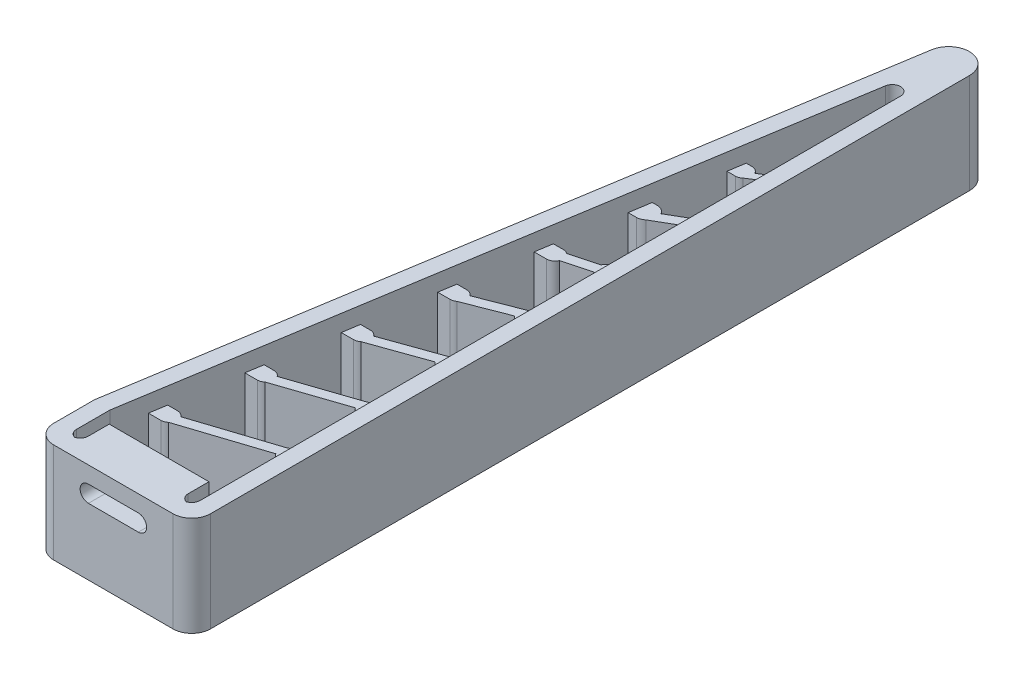
from build123d import *

# Parameters (mm, degrees)
BOSS_EXTRUDE1_DEPTH     = 6
BOSS_EXTRUDE2_DEPTH     = 4
SKETCH6_R               = 0.5
CUT_EXTRUDE1_DEPTH      = 1
FILL_START              = -19.748812638
FILL_PATTERN1_OUTLINE_R = 0.5
FILL_PATTERN1_DEPTH     = 1
FILLET1_R               = 2.25
FILLET2_R               = 1
CUT_EXTRUDE2_DEPTH      = 10


# Read off the part's stored shape, not the designer's step: Fill Pattern1
with BuildPart() as part:
    # Sketch1 → Boss-Extrude1 (new, symmetric)
    with BuildSketch(Plane(origin=(0, 0, 0), x_dir=(1, 0, 0), z_dir=(0, 1, 0))):
        with BuildLine():
            Line((0, 93.551263874), (0, 0))
            Line((0, 0), (-18.854561776, 0))
            Line((-18.854561776, 0), (-18.854561776, 7.158988901))
            Line((-18.854561776, 7.158988901), (-4.96860158, 93.946240126))
            ThreePointArc((-4.96860158, 93.946240126), (-2.301888856, 96.043401906), (0, 93.551263874))
        make_face()
        with BuildLine():
            Line((-16.854561776, 7), (-3.987440632, 87.419507149))
            ThreePointArc((-3.987440632, 87.419507149), (-2.920755543, 88.258371861), (-2, 87.261516648))
            Line((-2, 87.261516648), (-2, 2))
            Line((-2, 2), (-3.427280888, 2))
            Line((-3.427280888, 2), (-3.427280888, 5.5))
            Line((-3.427280888, 5.5), (-15.427280888, 5.5))
            Line((-15.427280888, 5.5), (-15.427280888, 2))
            Line((-15.427280888, 2), (-16.854561776, 2))
            Line((-16.854561776, 2), (-16.854561776, 7))
        make_face(mode=Mode.SUBTRACT)
    extrude(amount=BOSS_EXTRUDE1_DEPTH, both=True)

    # Sketch3 → Boss-Extrude2 (add, symmetric)
    with BuildSketch(Plane(origin=(0, 0, 0), x_dir=(1, 0, 0), z_dir=(0, 1, 0))):
        with BuildLine():
            ThreePointArc((-13.894581708, 12.572392076), (-14.252172371, 12.886676964), (-14.714561776, 13))
            Line((-14.714561776, 13), (-15.894561776, 13))
            Line((-15.894561776, 13), (-16.214561776, 11))
            Line((-16.214561776, 11), (-14.714561776, 11))
            ThreePointArc((-14.714561776, 11), (-14.351709518, 11.068153318), (-14.03831643, 11.263323523))
            Line((-14.03831643, 11.263323523), (-4.319980068, 14.432540695))
            ThreePointArc((-4.319980068, 14.432540695), (-3.962389405, 14.118255808), (-3.5, 14.004932771))
            Line((-3.5, 14.004932771), (-2, 14.004932771))
            Line((-2, 14.004932771), (-2, 16.004932771))
            Line((-2, 16.004932771), (-3.5, 16.004932771))
            ThreePointArc((-3.5, 16.004932771), (-3.862852258, 15.936779453), (-4.176245346, 15.741609249))
            Line((-4.176245346, 15.741609249), (-13.894581708, 12.572392076))
        make_face()
        with BuildLine():
            ThreePointArc((-3.5, 25.576214063), (-3.855885274, 25.510743716), (-4.165170683, 25.322905407))
            Line((-4.165170683, 25.322905407), (-12.294644799, 22.572482446))
            ThreePointArc((-12.294644799, 22.572482446), (-12.652221234, 22.886702443), (-13.114561776, 23))
            Line((-13.114561776, 23), (-14.294561776, 23))
            Line((-14.294561776, 23), (-14.614561776, 21))
            Line((-14.614561776, 21), (-13.114561776, 21))
            ThreePointArc((-13.114561776, 21), (-12.758676502, 21.065470347), (-12.449391093, 21.253308656))
            Line((-12.449391093, 21.253308656), (-4.319916977, 24.003731617))
            ThreePointArc((-4.319916977, 24.003731617), (-3.962340542, 23.68951162), (-3.5, 23.576214063))
            Line((-3.5, 23.576214063), (-2, 23.576214063))
            Line((-2, 23.576214063), (-2, 25.576214063))
            Line((-2, 25.576214063), (-3.5, 25.576214063))
        make_face()
        with BuildLine():
            Line((-3.5, 33.147495356), (-2, 33.147495356))
            Line((-2, 33.147495356), (-2, 35.147495356))
            Line((-2, 35.147495356), (-3.5, 35.147495356))
            ThreePointArc((-3.5, 35.147495356), (-3.839457159, 35.088116872), (-4.138601415, 34.91703303))
            Line((-4.138601415, 34.91703303), (-10.696730072, 32.575457474))
            ThreePointArc((-10.696730072, 32.575457474), (-11.05383272, 32.887540837), (-11.514561776, 33))
            Line((-11.514561776, 33), (-12.694561776, 33))
            Line((-12.694561776, 33), (-13.014561776, 31))
            Line((-13.014561776, 31), (-11.514561776, 31))
            ThreePointArc((-11.514561776, 31), (-11.17076538, 31.060955785), (-10.868881742, 31.236391923))
            Line((-10.868881742, 31.236391923), (-4.319739543, 33.57475887))
            ThreePointArc((-4.319739543, 33.57475887), (-3.962203156, 33.26072129), (-3.5, 33.147495356))
        make_face()
        with BuildLine():
            Line((-3.5, 42.718776648), (-2, 42.718776648))
            Line((-2, 42.718776648), (-2, 44.718776648))
            Line((-2, 44.718776648), (-3.5, 44.718776648))
            ThreePointArc((-3.5, 44.718776648), (-3.816868443, 44.667246146), (-4.101080107, 44.517965427))
            Line((-4.101080107, 44.517965427), (-9.095345948, 42.573485333))
            ThreePointArc((-9.095345948, 42.573485333), (-9.45276384, 42.886985156), (-9.914561776, 43))
            Line((-9.914561776, 43), (-11.094561776, 43))
            Line((-11.094561776, 43), (-11.414561776, 41))
            Line((-11.414561776, 41), (-9.914561776, 41))
            ThreePointArc((-9.914561776, 41), (-9.597693333, 41.051530501), (-9.313481669, 41.20081122))
            Line((-9.313481669, 41.20081122), (-4.319215828, 43.145291315))
            ThreePointArc((-4.319215828, 43.145291315), (-3.961797936, 42.831791492), (-3.5, 42.718776648))
        make_face()
        with BuildLine():
            ThreePointArc((-3.5, 54.29005794), (-4.060133797, 54.118460094), (-4.428032088, 53.662558199))
            Line((-4.428032088, 53.662558199), (-7.697112542, 52.786610732))
            ThreePointArc((-7.697112542, 52.786610732), (-7.98792033, 52.94514833), (-8.314561776, 53))
            Line((-8.314561776, 53), (-9.494561776, 53))
            Line((-9.494561776, 53), (-9.814561776, 51))
            Line((-9.814561776, 51), (-8.314561776, 51))
            ThreePointArc((-8.314561776, 51), (-7.754427979, 51.171597845), (-7.386529688, 51.62749974))
            Line((-7.386529688, 51.62749974), (-4.117449234, 52.503447208))
            ThreePointArc((-4.117449234, 52.503447208), (-3.826641446, 52.34490961), (-3.5, 52.29005794))
            Line((-3.5, 52.29005794), (-2, 52.29005794))
            Line((-2, 52.29005794), (-2, 54.29005794))
            Line((-2, 54.29005794), (-3.5, 54.29005794))
        make_face()
        with BuildLine():
            Line((-2, 71.640764886), (-2, 73.640764886))
            Line((-2, 73.640764886), (-2.6, 73.640764886))
            ThreePointArc((-2.6, 73.640764886), (-2.962784917, 73.572637787), (-3.276138866, 73.377539094))
            Line((-3.276138866, 73.377539094), (-4.72720833, 72.461089863))
            ThreePointArc((-4.72720833, 72.461089863), (-5.095471159, 72.854719212), (-5.614561776, 73))
            Line((-5.614561776, 73), (-6.294561776, 73))
            Line((-6.294561776, 73), (-6.614561776, 71))
            Line((-6.614561776, 71), (-5.614561776, 71))
            ThreePointArc((-5.614561776, 71), (-5.251776859, 71.068127099), (-4.93842291, 71.263225792))
            Line((-4.93842291, 71.263225792), (-3.487353446, 72.179675023))
            ThreePointArc((-3.487353446, 72.179675023), (-3.119090617, 71.786045674), (-2.6, 71.640764886))
            Line((-2.6, 71.640764886), (-2, 71.640764886))
        make_face()
        with BuildLine():
            Line((-2, 61.997186069), (-2, 64.497186069))
            Line((-2, 64.497186069), (-2.6, 64.497186069))
            ThreePointArc((-2.6, 64.497186069), (-3.040392748, 64.417038294), (-3.424311098, 64.186872833))
            Line((-3.424311098, 64.186872833), (-6.159837979, 62.603390263))
            ThreePointArc((-6.159837979, 62.603390263), (-6.618848723, 63.076275483), (-7.254561776, 63.25))
            Line((-7.254561776, 63.25), (-7.854561776, 63.25))
            Line((-7.854561776, 63.25), (-8.254561776, 60.75))
            Line((-8.254561776, 60.75), (-7.254561776, 60.75))
            ThreePointArc((-7.254561776, 60.75), (-6.814169028, 60.830147775), (-6.430250678, 61.060313236))
            Line((-6.430250678, 61.060313236), (-3.694723797, 62.643795806))
            ThreePointArc((-3.694723797, 62.643795806), (-3.235713053, 62.170910586), (-2.6, 61.997186069))
            Line((-2.6, 61.997186069), (-2, 61.997186069))
        make_face()
    extrude(amount=BOSS_EXTRUDE2_DEPTH, both=True)

    # Sketch6 → Cut-Extrude1 (cut)
    with BuildSketch(Plane(origin=(-19.500780031, 0, -3.120124805), x_dir=(-0.15799050110667284, 0, 0.9874406319167055), z_dir=(-0.9874406319167055, 0, -0.15799050110667284))):
        with Locations((-47.590234861, 0)):
            Circle(SKETCH6_R)
    extrude(amount=-CUT_EXTRUDE1_DEPTH, mode=Mode.SUBTRACT)

    # Fill Pattern1 outline → Fill Pattern1 (cut)
    with BuildSketch(Plane(origin=(0, 0, 0), x_dir=(0, 1, 0), z_dir=(0.9874406319167054, 0, 0.1579905011066731)).offset(FILL_START)):
        with Locations((3, -44.590234861)):
            Circle(FILL_PATTERN1_OUTLINE_R)
        with Locations((3, -83.590234861)):
            Circle(FILL_PATTERN1_OUTLINE_R)
        with Locations((3, -8.590234861)):
            Circle(FILL_PATTERN1_OUTLINE_R)
        with Locations((0, -8.590234861)):
            Circle(FILL_PATTERN1_OUTLINE_R)
        with Locations((-3, -8.590234861)):
            Circle(FILL_PATTERN1_OUTLINE_R)
        with Locations((-3, -86.590234861)):
            Circle(FILL_PATTERN1_OUTLINE_R)
        with Locations((0, -86.590234861)):
            Circle(FILL_PATTERN1_OUTLINE_R)
        with Locations((3, -86.590234861)):
            Circle(FILL_PATTERN1_OUTLINE_R)
        with Locations((3, -5.590234861)):
            Circle(FILL_PATTERN1_OUTLINE_R)
        with Locations((-3, -80.590234861)):
            Circle(FILL_PATTERN1_OUTLINE_R)
        with Locations((0, -80.590234861)):
            Circle(FILL_PATTERN1_OUTLINE_R)
        with Locations((3, -80.590234861)):
            Circle(FILL_PATTERN1_OUTLINE_R)
        with Locations((3, -11.590234861)):
            Circle(FILL_PATTERN1_OUTLINE_R)
        with Locations((0, -11.590234861)):
            Circle(FILL_PATTERN1_OUTLINE_R)
        with Locations((-3, -11.590234861)):
            Circle(FILL_PATTERN1_OUTLINE_R)
        with Locations((-3, -83.590234861)):
            Circle(FILL_PATTERN1_OUTLINE_R)
        with Locations((0, -83.590234861)):
            Circle(FILL_PATTERN1_OUTLINE_R)
        with Locations((0, -5.590234861)):
            Circle(FILL_PATTERN1_OUTLINE_R)
        with Locations((-3, -5.590234861)):
            Circle(FILL_PATTERN1_OUTLINE_R)
        with Locations((-3, -89.590234861)):
            Circle(FILL_PATTERN1_OUTLINE_R)
        with Locations((0, -89.590234861)):
            Circle(FILL_PATTERN1_OUTLINE_R)
        with Locations((3, -89.590234861)):
            Circle(FILL_PATTERN1_OUTLINE_R)
        with Locations((0, -59.590234861)):
            Circle(FILL_PATTERN1_OUTLINE_R)
        with Locations((-3, -59.590234861)):
            Circle(FILL_PATTERN1_OUTLINE_R)
        with Locations((-3, -35.590234861)):
            Circle(FILL_PATTERN1_OUTLINE_R)
        with Locations((0, -35.590234861)):
            Circle(FILL_PATTERN1_OUTLINE_R)
        with Locations((3, -35.590234861)):
            Circle(FILL_PATTERN1_OUTLINE_R)
        with Locations((3, -56.590234861)):
            Circle(FILL_PATTERN1_OUTLINE_R)
        with Locations((0, -56.590234861)):
            Circle(FILL_PATTERN1_OUTLINE_R)
        with Locations((-3, -56.590234861)):
            Circle(FILL_PATTERN1_OUTLINE_R)
        with Locations((3, -29.590234861)):
            Circle(FILL_PATTERN1_OUTLINE_R)
        with Locations((3, -62.590234861)):
            Circle(FILL_PATTERN1_OUTLINE_R)
        with Locations((0, -62.590234861)):
            Circle(FILL_PATTERN1_OUTLINE_R)
        with Locations((-3, -62.590234861)):
            Circle(FILL_PATTERN1_OUTLINE_R)
        with Locations((-3, -32.590234861)):
            Circle(FILL_PATTERN1_OUTLINE_R)
        with Locations((0, -32.590234861)):
            Circle(FILL_PATTERN1_OUTLINE_R)
        with Locations((3, -32.590234861)):
            Circle(FILL_PATTERN1_OUTLINE_R)
        with Locations((3, -59.590234861)):
            Circle(FILL_PATTERN1_OUTLINE_R)
        with Locations((3, -41.590234861)):
            Circle(FILL_PATTERN1_OUTLINE_R)
        with Locations((3, -47.590234861)):
            Circle(FILL_PATTERN1_OUTLINE_R)
        with Locations((3, -50.590234861)):
            Circle(FILL_PATTERN1_OUTLINE_R)
        with Locations((0, -50.590234861)):
            Circle(FILL_PATTERN1_OUTLINE_R)
        with Locations((-3, -50.590234861)):
            Circle(FILL_PATTERN1_OUTLINE_R)
        with Locations((-3, -47.590234861)):
            Circle(FILL_PATTERN1_OUTLINE_R)
        with Locations((-3, -44.590234861)):
            Circle(FILL_PATTERN1_OUTLINE_R)
        with Locations((0, -44.590234861)):
            Circle(FILL_PATTERN1_OUTLINE_R)
        with Locations((-3, -38.590234861)):
            Circle(FILL_PATTERN1_OUTLINE_R)
        with Locations((0, -38.590234861)):
            Circle(FILL_PATTERN1_OUTLINE_R)
        with Locations((3, -38.590234861)):
            Circle(FILL_PATTERN1_OUTLINE_R)
        with Locations((3, -53.590234861)):
            Circle(FILL_PATTERN1_OUTLINE_R)
        with Locations((0, -53.590234861)):
            Circle(FILL_PATTERN1_OUTLINE_R)
        with Locations((-3, -53.590234861)):
            Circle(FILL_PATTERN1_OUTLINE_R)
        with Locations((-3, -41.590234861)):
            Circle(FILL_PATTERN1_OUTLINE_R)
        with Locations((0, -41.590234861)):
            Circle(FILL_PATTERN1_OUTLINE_R)
        with Locations((3, -17.590234861)):
            Circle(FILL_PATTERN1_OUTLINE_R)
        with Locations((3, -74.590234861)):
            Circle(FILL_PATTERN1_OUTLINE_R)
        with Locations((0, -74.590234861)):
            Circle(FILL_PATTERN1_OUTLINE_R)
        with Locations((-3, -74.590234861)):
            Circle(FILL_PATTERN1_OUTLINE_R)
        with Locations((-3, -20.590234861)):
            Circle(FILL_PATTERN1_OUTLINE_R)
        with Locations((0, -20.590234861)):
            Circle(FILL_PATTERN1_OUTLINE_R)
        with Locations((3, -20.590234861)):
            Circle(FILL_PATTERN1_OUTLINE_R)
        with Locations((3, -71.590234861)):
            Circle(FILL_PATTERN1_OUTLINE_R)
        with Locations((-3, -14.590234861)):
            Circle(FILL_PATTERN1_OUTLINE_R)
        with Locations((0, -14.590234861)):
            Circle(FILL_PATTERN1_OUTLINE_R)
        with Locations((3, -14.590234861)):
            Circle(FILL_PATTERN1_OUTLINE_R)
        with Locations((3, -77.590234861)):
            Circle(FILL_PATTERN1_OUTLINE_R)
        with Locations((0, -77.590234861)):
            Circle(FILL_PATTERN1_OUTLINE_R)
        with Locations((-3, -77.590234861)):
            Circle(FILL_PATTERN1_OUTLINE_R)
        with Locations((-3, -17.590234861)):
            Circle(FILL_PATTERN1_OUTLINE_R)
        with Locations((0, -17.590234861)):
            Circle(FILL_PATTERN1_OUTLINE_R)
        with Locations((-3, -26.590234861)):
            Circle(FILL_PATTERN1_OUTLINE_R)
        with Locations((0, -26.590234861)):
            Circle(FILL_PATTERN1_OUTLINE_R)
        with Locations((3, -26.590234861)):
            Circle(FILL_PATTERN1_OUTLINE_R)
        with Locations((3, -65.590234861)):
            Circle(FILL_PATTERN1_OUTLINE_R)
        with Locations((0, -65.590234861)):
            Circle(FILL_PATTERN1_OUTLINE_R)
        with Locations((-3, -65.590234861)):
            Circle(FILL_PATTERN1_OUTLINE_R)
        with Locations((-3, -29.590234861)):
            Circle(FILL_PATTERN1_OUTLINE_R)
        with Locations((0, -29.590234861)):
            Circle(FILL_PATTERN1_OUTLINE_R)
        with Locations((0, -71.590234861)):
            Circle(FILL_PATTERN1_OUTLINE_R)
        with Locations((-3, -71.590234861)):
            Circle(FILL_PATTERN1_OUTLINE_R)
        with Locations((-3, -23.590234861)):
            Circle(FILL_PATTERN1_OUTLINE_R)
        with Locations((0, -23.590234861)):
            Circle(FILL_PATTERN1_OUTLINE_R)
        with Locations((3, -23.590234861)):
            Circle(FILL_PATTERN1_OUTLINE_R)
        with Locations((3, -68.590234861)):
            Circle(FILL_PATTERN1_OUTLINE_R)
        with Locations((0, -68.590234861)):
            Circle(FILL_PATTERN1_OUTLINE_R)
        with Locations((-3, -68.590234861)):
            Circle(FILL_PATTERN1_OUTLINE_R)
    extrude(amount=FILL_PATTERN1_DEPTH, mode=Mode.SUBTRACT)

    # Fillet1
    fillet1_edges = [part.edges().sort_by_distance(p)[0] for p in [
        (-18.854561776, 0, 0),
        (-18.854561776, 0, -7.158988901),
        (0, 0, 0),
    ]]
    fillet(fillet1_edges, radius=FILLET1_R)

    # Fillet2
    # the kernel refuses this fillet: 1 mm, written as the material it adds along each edge
    with BuildSketch(Plane(origin=(-3.427280888, 6, -2), x_dir=(0, 0, -1), z_dir=(0, -1, 0)), Plane(origin=(-2, 6, -2), x_dir=(-1, 0, 0), z_dir=(0, -1, 0)), Plane(origin=(-15.427280888, 6, -2), x_dir=(-1, 0, 0), z_dir=(0, -1, 0)), Plane(origin=(-16.854561776, 6, -2), x_dir=(0, 0, -1), z_dir=(0, -1, 0))) as fillet2_piece_1:
        with BuildLine():
            CenterArc((FILLET2_R, FILLET2_R), FILLET2_R, 180, 90)
            Line((0, FILLET2_R), (0, 0))
            Line((0, 0), (FILLET2_R, 0))
        make_face()
    extrude(amount=12)

    # Sketch7 → Cut-Extrude2 (cut)
    with BuildSketch(Plane(origin=(0, 0, -5.5), x_dir=(-1, 0, 0), z_dir=(0, 0, -1))):
        with BuildLine():
            Line((12.427280888, 4), (6.427280888, 4))
            ThreePointArc((6.427280888, 4), (5.427280888, 3), (6.427280888, 2))
            Line((6.427280888, 2), (12.427280888, 2))
            ThreePointArc((12.427280888, 2), (13.427280888, 3), (12.427280888, 4))
        make_face()
    extrude(amount=-CUT_EXTRUDE2_DEPTH, mode=Mode.SUBTRACT)


solid = part.part
